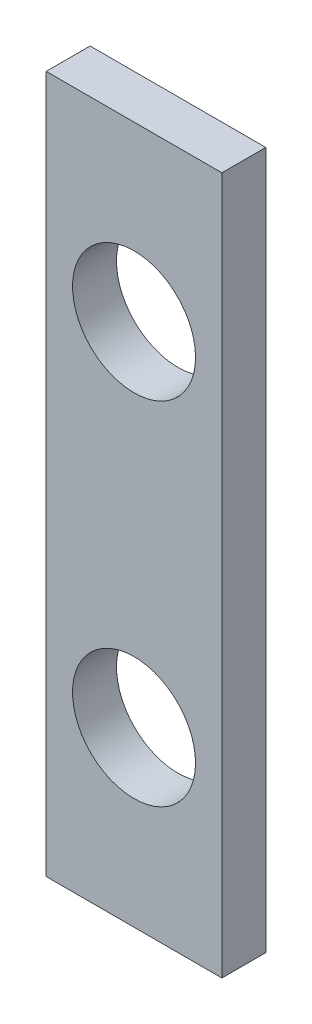
from build123d import *

# Parameters (mm, degrees)
SKETCH3_W           = 8
SKETCH3_H           = 2
BOSS_EXTRUDE2_DEPTH = 31.75
SKETCH4_R           = 2.8
CUT_EXTRUDE1_DEPTH  = 33.427248272


with BuildPart() as part:
    # Sketch3 → Boss-Extrude2 (new body)
    with BuildSketch(Plane(origin=(0, 0, 0), x_dir=(1, 0, 0), z_dir=(0, 1, 0))):
        with Locations((2.282032354, 3.507256135)):
            Rectangle(SKETCH3_W, SKETCH3_H)
    extrude(amount=BOSS_EXTRUDE2_DEPTH)

    # Sketch4 → Cut-Extrude1 (cut, through all)
    with BuildSketch(Plane.XY.offset(-2.507256135)):
        with Locations((2.282032354, 7.875)):
            Circle(SKETCH4_R)
        with Locations((2.282032354, 23.875)):
            Circle(SKETCH4_R)
    extrude(amount=-CUT_EXTRUDE1_DEPTH, mode=Mode.SUBTRACT)


solid = part.part
